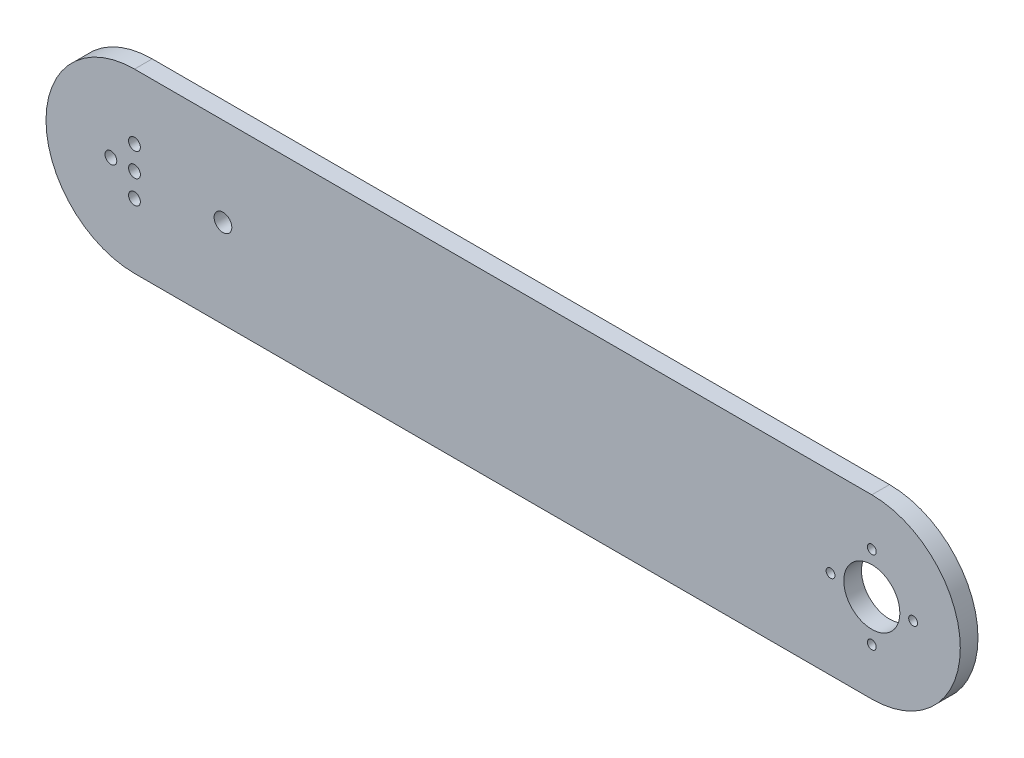
from build123d import *

# Parameters (mm, degrees)
SALIENTE_EXTRUIR1_DEPTH = 6
CROQUIS2_R              = 9.5
CROQUIS2_R_2            = 3
CROQUIS2_R_3            = 2
CORTAR_EXTRUIR4_DEPTH   = 220
CROQUIS7_R              = 1.5
CORTAR_EXTRUIR5_DEPTH   = 6


with BuildPart() as part:
    # Croquis1 → Saliente-Extruir1 (new body)
    with BuildSketch(Plane.XY):
        with BuildLine():
            Line((120, 0), (370, 0))
            ThreePointArc((370, 0), (400, 30), (370, 60))
            Line((370, 60), (120, 60))
            ThreePointArc((120, 60), (90, 30), (120, 0))
        make_face()
    extrude(amount=SALIENTE_EXTRUIR1_DEPTH)

    # Croquis2 → Cortar-Extruir4 (cut)
    with BuildSketch(Plane.XY.offset(6)):
        with Locations((370, 30)):
            Circle(CROQUIS2_R)
        with Locations((150, 30)):
            Circle(CROQUIS2_R_2)
        with Locations((120, 30)):
            Circle(CROQUIS2_R_3)
        with Locations((120, 22)):
            Circle(CROQUIS2_R_3)
        with Locations((120, 38)):
            Circle(CROQUIS2_R_3)
        with Locations((112, 30)):
            Circle(CROQUIS2_R_3)
    extrude(amount=-CORTAR_EXTRUIR4_DEPTH, mode=Mode.SUBTRACT)

    # Croquis7 → Cortar-Extruir5 (cut)
    with BuildSketch(Plane.XY.offset(6)):
        with Locations((370, 16)):
            Circle(CROQUIS7_R)
        with Locations((384, 30)):
            Circle(CROQUIS7_R)
        with Locations((356, 30)):
            Circle(CROQUIS7_R)
        with Locations((370, 44)):
            Circle(CROQUIS7_R)
    extrude(amount=-CORTAR_EXTRUIR5_DEPTH, mode=Mode.SUBTRACT)


solid = part.part
